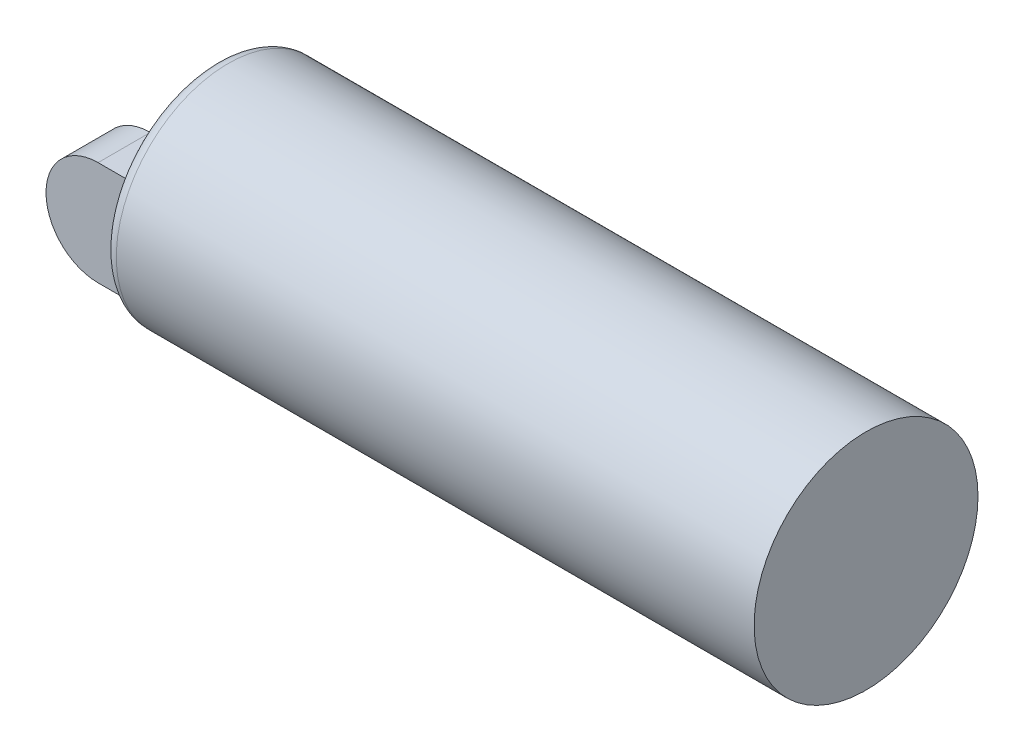
from build123d import *

# Parameters (mm, degrees)
ESBO_O4_R                = 4.3
RESSALTO_EXTRUS_O1_DEPTH = 25
ESBO_O5_W                = 7
ESBO_O5_H                = 4
RESSALTO_EXTRUS_O4_DEPTH = 3
ESBO_O7_W                = 2.98
ESBO_O7_H                = 4
CORTE_EXTRUS_O2_DEPTH    = 3
ESBO_O8_R                = 0.9
CORTE_EXTRUS_O3_DEPTH    = 2
FILETE2_RADIUS           = 2
FILETE2_LENGTH           = 2.01
FILETE3_RADIUS           = 2
FILETE3_LENGTH           = 2.01
FILETE4_R                = 0.5


with BuildPart() as part:
    # Esboço4 → Ressalto-extrusão1 (new body)
    with BuildSketch(Plane(origin=(0, 0, 0), x_dir=(0, 0, -1), z_dir=(1, 0, 0))):
        Circle(ESBO_O4_R)
    extrude(amount=-RESSALTO_EXTRUS_O1_DEPTH)

    # Esboço5 → Ressalto-extrusão4 (add)
    with BuildSketch(Plane.ZY.offset(25)):
        Rectangle(ESBO_O5_W, ESBO_O5_H)
    extrude(amount=RESSALTO_EXTRUS_O4_DEPTH)

    # Esboço7 → Corte-extrusão2 (cut)
    with BuildSketch(Plane.ZY.offset(28)):
        Rectangle(ESBO_O7_W, ESBO_O7_H)
    extrude(amount=-CORTE_EXTRUS_O2_DEPTH, mode=Mode.SUBTRACT)

    # Esboço8 → Corte-extrusão3 (cut)
    with BuildSketch(Plane.XY.offset(-1.49)):
        with Locations((-26.63, 0)):
            Circle(ESBO_O8_R)
    corte_extrus_o3 = extrude(amount=-CORTE_EXTRUS_O3_DEPTH, mode=Mode.SUBTRACT)

    # Filete2: full round fillet: the end face becomes a half cylinder, R = half its width
    filete2_face = Plane((-28, 0, -2.495), x_dir=(0, 0, -1), z_dir=(-1, 0, 0))  # on the end face: x along it, z out of the body
    filete2_slab = filete2_face.offset(-FILETE2_RADIUS / 2) * Box(FILETE2_LENGTH, 2 * FILETE2_RADIUS, FILETE2_RADIUS, mode=Mode.PRIVATE)  # the body's end, R deep
    filete2_round = Plane((-26, 0, -2.495), x_dir=(-1, 0, 0), z_dir=(0, 0, -1)) * Cylinder(FILETE2_RADIUS, FILETE2_LENGTH, mode=Mode.PRIVATE)  # its axis R under the face
    add(filete2_slab - filete2_round, mode=Mode.SUBTRACT)

    # Espelhar7: Corte-extrusão3 across plane
    add(corte_extrus_o3.mirror(Plane.XY), mode=Mode.SUBTRACT)

    # Filete3: full round fillet: the end face becomes a half cylinder, R = half its width
    filete3_face = Plane((-28, 0, 2.495), x_dir=(0, 0, 1), z_dir=(-1, 0, 0))  # on the end face: x along it, z out of the body
    filete3_slab = filete3_face.offset(-FILETE3_RADIUS / 2) * Box(FILETE3_LENGTH, 2 * FILETE3_RADIUS, FILETE3_RADIUS, mode=Mode.PRIVATE)  # the body's end, R deep
    filete3_round = Plane((-26, 0, 2.495), x_dir=(-1, 0, 0), z_dir=(0, 0, 1)) * Cylinder(FILETE3_RADIUS, FILETE3_LENGTH, mode=Mode.PRIVATE)  # its axis R under the face
    add(filete3_slab - filete3_round, mode=Mode.SUBTRACT)

    # Filete4
    # the kernel refuses this fillet: 0.5 mm, written as the material it takes off along each edge
    with BuildSketch(Plane(origin=(-25, 0, 0), x_dir=(0, 0, -1), z_dir=(0, -1, 0))) as filete4_piece_1_section:
        with BuildLine():
            CenterArc((4.3 - FILETE4_R, FILETE4_R), FILETE4_R, 270, 90)
            Line((4.3 - FILETE4_R, 0), (4.3, 0))
            Line((4.3, 0), (4.3, FILETE4_R))
        make_face()
    filete4_piece_1 = revolve(axis=Axis((-25, 0, 0), (1, 0, 0)), mode=Mode.PRIVATE)
    filete4_piece_1 = split(filete4_piece_1, bisect_by=Plane(origin=(-24.857838708, 1.067183876, -3.5), z_dir=(0, 0, -1)), keep=Keep.TOP, mode=Mode.PRIVATE)
    add(filete4_piece_1, mode=Mode.SUBTRACT)
    with BuildSketch(Plane(origin=(-25, 0, 0), x_dir=(0, 0, -1), z_dir=(0, -1, 0))) as filete4_piece_2_section:
        with BuildLine():
            CenterArc((4.3 - FILETE4_R, FILETE4_R), FILETE4_R, 270, 90)
            Line((4.3 - FILETE4_R, 0), (4.3, 0))
            Line((4.3, 0), (4.3, FILETE4_R))
        make_face()
    filete4_piece_2 = revolve(axis=Axis((-25, 0, 0), (1, 0, 0)), mode=Mode.PRIVATE)
    filete4_piece_2 = split(filete4_piece_2, bisect_by=Plane(origin=(-24.858947412, 2, 0), z_dir=(0, 1, 0)), keep=Keep.TOP, mode=Mode.PRIVATE)
    add(filete4_piece_2, mode=Mode.SUBTRACT)
    with BuildSketch(Plane(origin=(-25, 0, 0), x_dir=(0, 0, -1), z_dir=(0, -1, 0))) as filete4_piece_3_section:
        with BuildLine():
            CenterArc((4.3 - FILETE4_R, FILETE4_R), FILETE4_R, 270, 90)
            Line((4.3 - FILETE4_R, 0), (4.3, 0))
            Line((4.3, 0), (4.3, FILETE4_R))
        make_face()
    filete4_piece_3 = revolve(axis=Axis((-25, 0, 0), (1, 0, 0)), mode=Mode.PRIVATE)
    filete4_piece_3 = split(filete4_piece_3, bisect_by=Plane(origin=(-24.858947412, -2, 0), z_dir=(0, -1, 0)), keep=Keep.TOP, mode=Mode.PRIVATE)
    add(filete4_piece_3, mode=Mode.SUBTRACT)
    with BuildSketch(Plane(origin=(-25, 0, 0), x_dir=(0, 0, -1), z_dir=(0, -1, 0))) as filete4_piece_4_section:
        with BuildLine():
            CenterArc((4.3 - FILETE4_R, FILETE4_R), FILETE4_R, 270, 90)
            Line((4.3 - FILETE4_R, 0), (4.3, 0))
            Line((4.3, 0), (4.3, FILETE4_R))
        make_face()
    filete4_piece_4 = revolve(axis=Axis((-25, 0, 0), (1, 0, 0)), mode=Mode.PRIVATE)
    filete4_piece_4 = split(filete4_piece_4, bisect_by=Plane(origin=(-24.85783871, 0, 3.5), z_dir=(0, 0, 1)), keep=Keep.TOP, mode=Mode.PRIVATE)
    add(filete4_piece_4, mode=Mode.SUBTRACT)


solid = part.part
